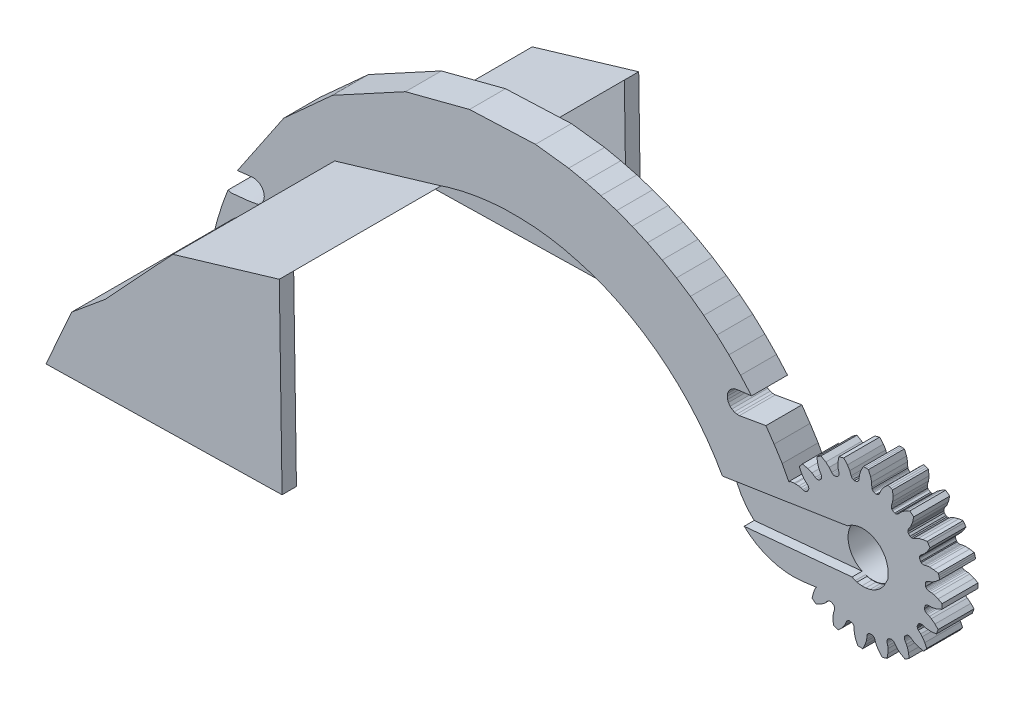
from build123d import *

# Parameters (mm, degrees)
EXTRUDE_1_DEPTH       = 5
EXTRUDE_4_DEPTH       = 1.4
EXTRUDE_6_DEPTH       = 22.5
EXTRUDE_8_DEPTH       = 2
EXTRUDE_9_DEPTH       = 27.5
EXTRUDE_10_DEPTH      = 2
EXTRUDE_11_DEPTH      = 10
EXTRUDE_11_DEPTH_BACK = 10
SKETCH_9_R            = 3.466997203


with BuildPart() as part:
    # 草图1 → 凸台-拉伸1 (new body)
    with BuildSketch(Plane.XY):
        with BuildLine():
            Line((78.264656067, 198.610534668), (77.453453766, 196.42377973))
            Line((77.453453766, 196.42377973), (76.780570984, 194.258041382))
            Line((76.780570984, 194.258041382), (76.215156555, 192.028518677))
            Line((76.215156555, 192.028518677), (75.769775391, 189.771942139))
            Line((75.769775391, 189.771942139), (75.44568634, 187.494781494))
            add(Edge.make_bspline(
                [(75.44568634, 187.494781494), (76.927870314, 189.989071683), (79.030409969, 193.790267145), (83.395802647, 196.817035543), (88.428386409, 203.376900855), (94.316934386, 207.548074621), (99.727897644, 209.947021484)],
                knots=[0, 0, 0, 0, 0.264078705, 0.372827909, 0.469719962, 1, 1, 1, 1], degree=3))
            Line((99.727897644, 209.947021484), (101.460605177, 211.048057001))
            Line((101.460605177, 211.048057001), (103.202568319, 211.994819762))
            Line((103.202568319, 211.994819762), (105.056091309, 212.862045288))
            Line((105.056091309, 212.862045288), (106.940231323, 213.609664917))
            Line((106.940231323, 213.609664917), (108.866714478, 214.240203857))
            Line((108.866714478, 214.240203857), (110.828269958, 214.751251221))
            Line((110.828269958, 214.751251221), (112.817504883, 215.140914917))
            Line((112.817504883, 215.140914917), (114.826911926, 215.407714844))
            Line((114.826911926, 215.407714844), (116.8489151, 215.550628662))
            Line((116.8489151, 215.550628662), (118.909233574, 215.550628662))
            Line((118.909233574, 215.550628662), (120.900138855, 215.463150024))
            Line((120.900138855, 215.463150024), (122.914085388, 215.233093262))
            Line((122.914085388, 215.233093262), (124.910102844, 214.879821777))
            Line((124.910102844, 214.879821777), (126.834763705, 214.391721334))
            Line((126.834763705, 214.391721334), (128.818344116, 213.809417725))
            Line((128.818344116, 213.809417725), (130.715805054, 213.096328735))
            Line((130.715805054, 213.096328735), (132.565917969, 212.268081665))
            Line((132.565917969, 212.268081665), (134.361694336, 211.327804565))
            Line((134.361694336, 211.327804565), (136.096343994, 210.279067993))
            Line((136.096343994, 210.279067993), (137.763336182, 209.125793457))
            Line((137.763336182, 209.125793457), (139.356369019, 207.872344971))
            Line((139.356369019, 207.872344971), (140.869445801, 206.523452759))
            Line((140.869445801, 206.523452759), (142.296859741, 205.084213257))
            Line((142.296859741, 205.084213257), (143.63319397, 203.560043335))
            Line((143.63319397, 203.560043335), (144.873443604, 201.956710815))
            Line((144.873443604, 201.956710815), (146.012908936, 200.280258179))
            Line((146.012908936, 200.280258179), (147.047302246, 198.537002563))
            Line((147.047302246, 198.537002563), (147.325256348, 198.023300171))
            Line((147.325256348, 198.023300171), (148.297051374, 196.133599791))
            Line((148.297051374, 196.133599791), (148.816299438, 195.392700195))
            Line((148.816299438, 195.392700195), (149.404052734, 194.672164917))
            Line((149.404052734, 194.672164917), (150.069362473, 193.996589296))
            Line((150.069362473, 193.996589296), (150.889770508, 193.31741333))
            Line((150.889770508, 193.31741333), (151.790487691, 192.704145824))
            Line((151.790487691, 192.704145824), (152.807807058, 192.192287023))
            Line((152.807807058, 192.192287023), (153.76713562, 191.833862305))
            Line((153.76713562, 191.833862305), (154.81427002, 191.556121826))
            Line((154.81427002, 191.556121826), (155.885299683, 191.393295288))
            Line((155.885299683, 191.393295288), (156.966659816, 191.341321766))
            Line((156.966659816, 191.341321766), (158.092749178, 191.411702351))
            Line((158.092749178, 191.411702351), (160.134979248, 191.670349121))
            Line((160.134979248, 191.670349121), (159.859750808, 191.266116086))
            Line((159.859750808, 191.266116086), (159.715805054, 190.809570312))
            Line((159.715805054, 190.809570312), (159.516505371, 190.058172624))
            Line((159.516505371, 190.058172624), (160.091796875, 189.630554199))
            Line((160.091796875, 189.630554199), (160.659439087, 189.90435791))
            Line((160.659439087, 189.90435791), (161.182632446, 190.255157471))
            Line((161.182632446, 190.255157471), (161.410995483, 190.463241577))
            Line((161.410995483, 190.463241577), (161.58543396, 190.677780151))
            Line((161.58543396, 190.677780151), (161.692504883, 190.791259766))
            Line((161.692504883, 190.791259766), (161.784912109, 190.863128662))
            Line((161.784912109, 190.863128662), (161.890118998, 190.917232229))
            Line((161.890118998, 190.917232229), (162.000886547, 190.946256775))
            Line((162.000886547, 190.946256775), (162.100771204, 190.952499566))
            Line((162.100771204, 190.952499566), (162.198223238, 190.926651523))
            Line((162.198223238, 190.926651523), (162.466125488, 190.783065796))
            Line((162.466125488, 190.783065796), (162.543994142, 190.709594727))
            Line((162.543994142, 190.709594727), (162.596600151, 190.63113649))
            Line((162.596600151, 190.63113649), (162.636917114, 190.538970947))
            Line((162.636917114, 190.538970947), (162.654587465, 190.399448921))
            Line((162.654587465, 190.399448921), (162.634307861, 190.225845337))
            Line((162.634307861, 190.225845337), (162.474197388, 189.679443359))
            Line((162.474197388, 189.679443359), (162.427825928, 189.057571411))
            Line((162.427825928, 189.057571411), (162.495518148, 188.297078962))
            Line((162.495518148, 188.297078962), (163.146405385, 188.053894213))
            Line((163.146405385, 188.053894213), (163.608964331, 188.475377332))
            Line((163.608964331, 188.475377332), (163.992094919, 188.99081764))
            Line((163.992094919, 188.99081764), (164.147079468, 189.251144409))
            Line((164.147079468, 189.251144409), (164.246673584, 189.509094238))
            Line((164.246673584, 189.509094238), (164.313430786, 189.650100708))
            Line((164.313430786, 189.650100708), (164.380578859, 189.748722308))
            Line((164.380578859, 189.748722308), (164.458311128, 189.831107215))
            Line((164.458311128, 189.831107215), (164.555194872, 189.896067471))
            Line((164.555194872, 189.896067471), (164.655181885, 189.928314209))
            Line((164.655181885, 189.928314209), (164.748458862, 189.936447144))
            Line((164.748458862, 189.936447144), (165.049590299, 189.878941092))
            Line((165.049590299, 189.878941092), (165.14407616, 189.842460216))
            Line((165.14407616, 189.842460216), (165.225631714, 189.780731201))
            Line((165.225631714, 189.780731201), (165.285394477, 189.703889737))
            Line((165.285394477, 189.703889737), (165.347625732, 189.579925537))
            Line((165.347625732, 189.579925537), (165.400436401, 188.834259033))
            Line((165.400436401, 188.834259033), (165.563063403, 188.213619025))
            Line((165.563063403, 188.213619025), (165.866304054, 187.520403633))
            Line((165.866304054, 187.520403633), (166.568621653, 187.486648071))
            Line((166.568621653, 187.486648071), (166.844284058, 188.049972534))
            Line((166.844284058, 188.049972534), (167.061340332, 188.641281128))
            Line((167.061340332, 188.641281128), (167.123794556, 188.943862915))
            Line((167.123794556, 188.943862915), (167.138793945, 189.219955444))
            Line((167.138793945, 189.219955444), (167.171852481, 189.380119324))
            Line((167.171852481, 189.380119324), (167.198473475, 189.509094238))
            Line((167.198473475, 189.509094238), (167.242706299, 189.59223938))
            Line((167.242706299, 189.59223938), (167.31602478, 189.683319092))
            Line((167.31602478, 189.683319092), (167.397766113, 189.744903564))
            Line((167.397766113, 189.744903564), (167.483963013, 189.781463623))
            Line((167.483963013, 189.781463623), (167.789428711, 189.822784424))
            Line((167.789428711, 189.822784424), (167.89175415, 189.81401062))
            Line((167.89175415, 189.81401062), (167.985916138, 189.780822754))
            Line((167.985916138, 189.780822754), (168.071075439, 189.725708008))
            Line((168.071075439, 189.725708008), (168.163986206, 189.627548218))
            Line((168.163986206, 189.627548218), (168.25302124, 189.470855713))
            Line((168.25302124, 189.470855713), (168.444641113, 188.934677124))
            Line((168.444641113, 188.934677124), (168.772659302, 188.404312134))
            Line((168.772659302, 188.404312134), (169.279785156, 187.824676514))
            Line((169.279785156, 187.824676514), (169.503845215, 187.883346558))
            Line((169.503845215, 187.883346558), (169.726623535, 187.946731567))
            Line((169.726623535, 187.946731567), (169.948028564, 188.014785767))
            Line((169.948028564, 188.014785767), (170.05595994, 188.636949007))
            Line((170.05595994, 188.636949007), (170.083877563, 189.264404297))
            Line((170.083877563, 189.264404297), (170.050202063, 189.570267264))
            Line((170.050202063, 189.570267264), (169.978729248, 189.838699341))
            Line((169.978729248, 189.838699341), (169.949859619, 189.992019653))
            Line((169.949859619, 189.992019653), (169.946044922, 190.109024048))
            Line((169.946044922, 190.109024048), (169.962524414, 190.224868774))
            Line((169.962524414, 190.224868774), (170.004104614, 190.334152222))
            Line((170.004104614, 190.334152222), (170.062805176, 190.41796875))
            Line((170.062805176, 190.41796875), (170.133483887, 190.479385376))
            Line((170.133483887, 190.479385376), (170.411224365, 190.613082886))
            Line((170.411224365, 190.613082886), (170.511276245, 190.63633728))
            Line((170.511276245, 190.63633728), (170.611068726, 190.633880615))
            Line((170.611068726, 190.633880615), (170.709091187, 190.607772827))
            Line((170.709091187, 190.607772827), (170.827789307, 190.543136597))
            Line((170.827789307, 190.543136597), (170.960891724, 190.421615601))
            Line((170.960891724, 190.421615601), (171.308807373, 189.970916748))
            Line((171.308807373, 189.970916748), (171.784667969, 189.567871094))
            Line((171.784667969, 189.567871094), (172.446090698, 189.173309326))
            Line((172.446090698, 189.173309326), (172.641067505, 189.298339844))
            Line((172.641067505, 189.298339844), (173.022888184, 189.56060791))
            Line((173.022888184, 189.56060791), (172.937896729, 190.185073853))
            Line((172.937896729, 190.185073853), (172.765945435, 190.791061401))
            Line((172.765945435, 190.791061401), (172.63861084, 191.072540283))
            Line((172.63861084, 191.072540283), (172.488464355, 191.304733276))
            Line((172.488464355, 191.304733276), (172.413635254, 191.441635132))
            Line((172.413635254, 191.441635132), (172.373840332, 191.551742554))
            Line((172.373840332, 191.551742554), (172.353713989, 191.666992188))
            Line((172.353713989, 191.666992188), (172.359481812, 191.783782959))
            Line((172.359481812, 191.783782959), (172.389419556, 191.881637573))
            Line((172.389419556, 191.881637573), (172.437652588, 191.961898804))
            Line((172.437652588, 191.961898804), (172.660491943, 192.174865723))
            Line((172.660491943, 192.174865723), (172.748458862, 192.227905273))
            Line((172.748458862, 192.227905273), (172.84413147, 192.256408691))
            Line((172.84413147, 192.256408691), (172.945419312, 192.261871338))
            Line((172.945419312, 192.261871338), (173.078277588, 192.237060547))
            Line((173.078277588, 192.237060547), (173.24176516, 192.163153056))
            Line((173.24176516, 192.163153056), (173.712585449, 191.841506958))
            Line((173.712585449, 191.841506958), (174.289703369, 191.605224609))
            Line((174.289703369, 191.605224609), (175.04069519, 191.434371948))
            Line((175.04069519, 191.434371948), (175.187469482, 191.613540649))
            Line((175.187469482, 191.613540649), (175.330444336, 191.795761108))
            Line((175.330444336, 191.795761108), (175.472895551, 191.977314194))
            Line((175.472895551, 191.977314194), (175.20033371, 192.548909475))
            Line((175.20033371, 192.548909475), (174.844955444, 193.071777344))
            Line((174.844955444, 193.071777344), (174.633390521, 193.31741333))
            Line((174.633390521, 193.31741333), (174.425745412, 193.480337017))
            Line((174.425745412, 193.480337017), (174.297353288, 193.581076776))
            Line((174.297353288, 193.581076776), (174.24680065, 193.687091796))
            Line((174.24680065, 193.687091796), (174.182235718, 193.77746582))
            Line((174.182235718, 193.77746582), (174.151626587, 193.890319824))
            Line((174.151626587, 193.890319824), (174.151626587, 193.996589296))
            Line((174.151626587, 193.996589296), (174.170944214, 194.083877563))
            Line((174.170944214, 194.083877563), (174.317047119, 194.355285645))
            Line((174.317047119, 194.355285645), (174.382469416, 194.438665908))
            Line((174.382469416, 194.438665908), (174.466506958, 194.489578247))
            Line((174.466506958, 194.489578247), (174.561157227, 194.526077271))
            Line((174.561157227, 194.526077271), (174.695175171, 194.543533325))
            Line((174.695175171, 194.543533325), (174.874282837, 194.523468018))
            Line((174.874282837, 194.523468018), (175.420669556, 194.363357544))
            Line((175.420669556, 194.363357544), (176.042556763, 194.316970825))
            Line((176.042556763, 194.316970825), (176.809570312, 194.386550903))
            Line((176.809570312, 194.386550903), (177.048568726, 195.038909912))
            Line((177.048568726, 195.038909912), (176.612747192, 195.494155884))
            Line((176.612747192, 195.494155884), (176.117446899, 195.883331299))
            Line((176.117446899, 195.883331299), (175.848983765, 196.036224365))
            Line((175.848983765, 196.036224365), (175.591033936, 196.135818481))
            Line((175.591033936, 196.135818481), (175.450012207, 196.202590942))
            Line((175.450012207, 196.202590942), (175.353118896, 196.268280029))
            Line((175.353118896, 196.268280029), (175.269088745, 196.349685669))
            Line((175.269088745, 196.349685669), (175.205108643, 196.447555542))
            Line((175.205108643, 196.447555542), (175.171813965, 196.544326782))
            Line((175.171813965, 196.544326782), (175.163665771, 196.63760376))
            Line((175.163665771, 196.63760376), (175.21875, 196.940887451))
            Line((175.21875, 196.940887451), (175.258743286, 197.035491943))
            Line((175.258743286, 197.035491943), (175.319381714, 197.11479187))
            Line((175.319381714, 197.11479187), (175.398132324, 197.178741455))
            Line((175.398132324, 197.178741455), (175.520187378, 197.23677063))
            Line((175.520187378, 197.23677063), (175.696731567, 197.273025513))
            Line((175.696731567, 197.273025513), (176.265869141, 197.289596558))
            Line((176.265869141, 197.289596558), (176.871643066, 197.437652588))
            Line((176.871643066, 197.437652588), (177.579362187, 197.743898648))
            Line((177.579362187, 197.743898648), (177.60408915, 198.438005701))
            Line((177.60408915, 198.438005701), (177.05015564, 198.733428955))
            Line((177.05015564, 198.733428955), (176.458831787, 198.950500488))
            Line((176.458831787, 198.950500488), (176.154274267, 199.005816077))
            Line((176.154274267, 199.005816077), (175.879499888, 199.026311565))
            Line((175.879499888, 199.026311565), (175.72000885, 199.055279298))
            Line((175.72000885, 199.055279298), (175.612960815, 199.08039856))
            Line((175.612960815, 199.08039856), (175.507888794, 199.131866455))
            Line((175.507888794, 199.131866455), (175.416793823, 199.205184937))
            Line((175.416793823, 199.205184937), (175.355224609, 199.28692627))
            Line((175.355224609, 199.28692627), (175.318649292, 199.373123169))
            Line((175.318649292, 199.373123169), (175.277328491, 199.678573608))
            Line((175.277328491, 199.678573608), (175.286117554, 199.780914307))
            Line((175.286117554, 199.780914307), (175.319290161, 199.875076294))
            Line((175.319290161, 199.875076294), (175.374420166, 199.960235596))
            Line((175.374420166, 199.960235596), (175.472579956, 200.053131104))
            Line((175.472579956, 200.053131104), (175.629272461, 200.142166138))
            Line((175.629272461, 200.142166138), (176.165435791, 200.33380127))
            Line((176.165435791, 200.33380127), (176.695800781, 200.661804199))
            Line((176.695800781, 200.661804199), (177.281288166, 201.166081262))
            Line((177.281288166, 201.166081262), (177.216766357, 201.393005371))
            Line((177.216766357, 201.393005371), (177.153396606, 201.615783691))
            Line((177.153396606, 201.615783691), (177.085342407, 201.837188721))
            Line((177.085342407, 201.837188721), (176.459790205, 201.950805316))
            Line((176.459790205, 201.950805316), (175.844705081, 201.972717191))
            Line((175.844705081, 201.972717191), (175.528656006, 201.938934326))
            Line((175.528656006, 201.938934326), (175.258956909, 201.873017693))
            Line((175.258956909, 201.873017693), (175.108093262, 201.839019775))
            Line((175.108093262, 201.839019775), (174.991088867, 201.835205078))
            Line((174.991088867, 201.835205078), (174.874282837, 201.8564201))
            Line((174.874282837, 201.8564201), (174.761504478, 201.896151124))
            Line((174.761504478, 201.896151124), (174.695175171, 201.939091061))
            Line((174.695175171, 201.939091061), (174.620727539, 202.022644043))
            Line((174.620727539, 202.022644043), (174.487045288, 202.300384521))
            Line((174.487045288, 202.300384521), (174.463775635, 202.400421143))
            Line((174.463775635, 202.400421143), (174.463775635, 202.500749883))
            Line((174.463775635, 202.500749883), (174.499846213, 202.603137895))
            Line((174.499846213, 202.603137895), (174.556991577, 202.716934204))
            Line((174.556991577, 202.716934204), (174.678497314, 202.850036621))
            Line((174.678497314, 202.850036621), (175.129211426, 203.197967529))
            Line((175.129211426, 203.197967529), (175.53225708, 203.673812866))
            Line((175.53225708, 203.673812866), (175.928875459, 204.335451875))
            Line((175.928875459, 204.335451875), (175.801773071, 204.530212402))
            Line((175.801773071, 204.530212402), (175.67342988, 204.726874228))
            Line((175.67342988, 204.726874228), (175.539505005, 204.91204834))
            Line((175.539505005, 204.91204834), (174.932685852, 204.829958907))
            Line((174.932685852, 204.829958907), (174.309066772, 204.655090332))
            Line((174.309066772, 204.655090332), (174.042688953, 204.526877164))
            Line((174.042688953, 204.526877164), (173.790767028, 204.405621919))
            Line((173.790767028, 204.405621919), (173.667177746, 204.316237506))
            Line((173.667177746, 204.316237506), (173.54838562, 204.263000488))
            Line((173.54838562, 204.263000488), (173.431262537, 204.247156283))
            Line((173.431262537, 204.247156283), (173.316760263, 204.251235327))
            Line((173.316760263, 204.251235327), (173.21986194, 204.285371926))
            Line((173.21986194, 204.285371926), (173.13822937, 204.326812744))
            Line((173.13822937, 204.326812744), (172.925247192, 204.5496521))
            Line((172.925247192, 204.5496521), (172.843704224, 204.733276367))
            Line((172.843704224, 204.733276367), (172.838241577, 204.834579468))
            Line((172.838241577, 204.834579468), (172.863052368, 204.967437744))
            Line((172.863052368, 204.967437744), (172.937484741, 205.131561279))
            Line((172.937484741, 205.131561279), (173.258621216, 205.601745605))
            Line((173.258621216, 205.601745605), (173.494888306, 206.178848267))
            Line((173.494888306, 206.178848267), (173.671154549, 206.930023))
            Line((173.671154549, 206.930023), (173.106703455, 207.361642905))
            Line((173.106703455, 207.361642905), (172.551513672, 207.084915161))
            Line((172.551513672, 207.084915161), (172.028335571, 206.734115601))
            Line((172.028335571, 206.734115601), (171.799972534, 206.526031494))
            Line((171.799972534, 206.526031494), (171.625549316, 206.31149292))
            Line((171.625549316, 206.31149292), (171.518463135, 206.198013306))
            Line((171.518463135, 206.198013306), (171.426055908, 206.126144409))
            Line((171.426055908, 206.126144409), (171.319196094, 206.072881406))
            Line((171.319196094, 206.072881406), (171.212419555, 206.042940274))
            Line((171.212419555, 206.042940274), (171.112853067, 206.042940274))
            Line((171.112853067, 206.042940274), (171.01625061, 206.06010437))
            Line((171.01625061, 206.06010437), (170.744842529, 206.206207275))
            Line((170.744842529, 206.206207275), (170.667221069, 206.273468018))
            Line((170.667221069, 206.273468018), (170.610534668, 206.355651855))
            Line((170.610534668, 206.355651855), (170.581810401, 206.458088789))
            Line((170.581810401, 206.458088789), (170.564108727, 206.588942603))
            Line((170.564108727, 206.588942603), (170.570206432, 206.760110424))
            Line((170.570206432, 206.760110424), (170.73677063, 207.309829712))
            Line((170.73677063, 207.309829712), (170.78314209, 207.93170166))
            Line((170.78314209, 207.93170166), (170.713577271, 208.698730469))
            Line((170.713577271, 208.698730469), (170.500880961, 208.785812124))
            Line((170.500880961, 208.785812124), (170.280334473, 208.862640381))
            Line((170.280334473, 208.862640381), (170.061203003, 208.937713623))
            Line((170.061203003, 208.937713623), (169.605957031, 208.50189209))
            Line((169.605957031, 208.50189209), (169.216781616, 208.006591797))
            Line((169.216781616, 208.006591797), (169.056104855, 207.738550731))
            Line((169.056104855, 207.738550731), (168.966445469, 207.481170654))
            Line((168.966445469, 207.481170654), (168.897537231, 207.339172363))
            Line((168.897537231, 207.339172363), (168.834645015, 207.234255532))
            Line((168.834645015, 207.234255532), (168.750427246, 207.158233643))
            Line((168.750427246, 207.158233643), (168.659569755, 207.095564578))
            Line((168.659569755, 207.095564578), (168.557736141, 207.067009488))
            Line((168.557736141, 207.067009488), (168.462524414, 207.052825928))
            Line((168.462524414, 207.052825928), (168.159240723, 207.107910156))
            Line((168.159240723, 207.107910156), (168.064620972, 207.147888184))
            Line((168.064620972, 207.147888184), (167.985321045, 207.20854187))
            Line((167.985321045, 207.20854187), (167.92137146, 207.287277222))
            Line((167.92137146, 207.287277222), (167.860116264, 207.410171509))
            Line((167.860116264, 207.410171509), (167.827102661, 207.585891724))
            Line((167.827102661, 207.585891724), (167.810516357, 208.155029297))
            Line((167.810516357, 208.155029297), (167.662460327, 208.760787964))
            Line((167.662460327, 208.760787964), (167.360879369, 209.471522562))
            Line((167.360879369, 209.471522562), (167.128036499, 209.482223511))
            Line((167.128036499, 209.482223511), (166.896575928, 209.490783691))
            Line((166.896575928, 209.490783691), (166.664978027, 209.494476318))
            Line((166.664978027, 209.494476318), (166.366699219, 208.939300537))
            Line((166.366699219, 208.939300537), (166.149627686, 208.347991943))
            Line((166.149627686, 208.347991943), (166.087173462, 208.045410156))
            Line((166.087173462, 208.045410156), (166.076917315, 207.768091983))
            Line((166.076917315, 207.768091983), (166.052246094, 207.614578247))
            Line((166.052246094, 207.614578247), (166.019714355, 207.502120972))
            Line((166.019714355, 207.502120972), (165.96824646, 207.397033691))
            Line((165.96824646, 207.397033691), (165.894927979, 207.305953979))
            Line((165.894927979, 207.305953979), (165.813201904, 207.244369507))
            Line((165.813201904, 207.244369507), (165.72670336, 207.207666195))
            Line((165.72670336, 207.207666195), (165.421539307, 207.166488647))
            Line((165.421539307, 207.166488647), (165.321823853, 207.182513937))
            Line((165.321823853, 207.182513937), (165.225631714, 207.210340482))
            Line((165.225631714, 207.210340482), (165.139892578, 207.263565063))
            Line((165.139892578, 207.263565063), (165.046981812, 207.361724854))
            Line((165.046981812, 207.361724854), (164.957962036, 207.518432617))
            Line((164.957962036, 207.518432617), (164.766326904, 208.054595947))
            Line((164.766326904, 208.054595947), (164.438323975, 208.584960938))
            Line((164.438323975, 208.584960938), (163.923599984, 209.162638471))
            Line((163.923599984, 209.162638471), (163.257487464, 208.975854341))
            Line((163.257487464, 208.975854341), (163.146405385, 208.364256726))
            Line((163.146405385, 208.364256726), (163.127075195, 207.724868774))
            Line((163.127075195, 207.724868774), (163.161193848, 207.417800903))
            Line((163.161193848, 207.417800903), (163.23223877, 207.15057373))
            Line((163.23223877, 207.15057373), (163.26109314, 206.997253418))
            Line((163.26109314, 206.997253418), (163.264923096, 206.880249023))
            Line((163.264923096, 206.880249023), (163.248458862, 206.764404297))
            Line((163.248458862, 206.764404297), (163.206863403, 206.65512085))
            Line((163.206863403, 206.65512085), (163.144140898, 206.57719091))
            Line((163.144140898, 206.57719091), (163.068711768, 206.509981818))
            Line((163.068711768, 206.509981818), (162.799743652, 206.376190186))
            Line((162.799743652, 206.376190186), (162.699707031, 206.352935791))
            Line((162.699707031, 206.352935791), (162.599899292, 206.355392456))
            Line((162.599899292, 206.355392456), (162.501876831, 206.381500244))
            Line((162.501876831, 206.381500244), (162.383178711, 206.446151733))
            Line((162.383178711, 206.446151733), (162.250091553, 206.567657471))
            Line((162.250091553, 206.567657471), (161.902145386, 207.018356323))
            Line((161.902145386, 207.018356323), (161.426300049, 207.421401978))
            Line((161.426300049, 207.421401978), (160.764877319, 207.815963745))
            Line((160.764877319, 207.815963745), (160.570456561, 207.685601414))
            Line((160.570456561, 207.685601414), (160.188079834, 207.428665161))
            Line((160.188079834, 207.428665161), (160.273071289, 206.804199219))
            Line((160.273071289, 206.804199219), (160.442893548, 206.198576392))
            Line((160.442893548, 206.198576392), (160.572357178, 205.916732788))
            Line((160.572357178, 205.916732788), (160.722488403, 205.684539795))
            Line((160.722488403, 205.684539795), (160.797332764, 205.547637939))
            Line((160.797332764, 205.547637939), (160.837127686, 205.437530518))
            Line((160.837127686, 205.437530518), (160.857254028, 205.322280884))
            Line((160.857254028, 205.322280884), (160.851470947, 205.205490112))
            Line((160.851470947, 205.205490112), (160.821548462, 205.107635498))
            Line((160.821548462, 205.107635498), (160.773300171, 205.027389526))
            Line((160.773300171, 205.027389526), (160.550476074, 204.814407349))
            Line((160.550476074, 204.814407349), (160.462524414, 204.761367798))
            Line((160.462524414, 204.761367798), (160.366836548, 204.73286438))
            Line((160.366836548, 204.73286438), (160.265548706, 204.727401733))
            Line((160.265548706, 204.727401733), (160.13269043, 204.752212524))
            Line((160.13269043, 204.752212524), (159.968551636, 204.826644897))
            Line((159.968551636, 204.826644897), (159.49836731, 205.147766113))
            Line((159.49836731, 205.147766113), (158.921265399, 205.384051762))
            Line((158.921265399, 205.384051762), (158.170288086, 205.554901123))
            Line((158.170288086, 205.554901123), (157.735604991, 205.014826601))
            Line((157.735604991, 205.014826601), (158.015213013, 204.440673828))
            Line((158.015213013, 204.440673828), (158.366012573, 203.917495728))
            Line((158.366012573, 203.917495728), (158.573646528, 203.684467011))
            Line((158.573646528, 203.684467011), (158.785147684, 203.514238694))
            Line((158.785147684, 203.514238694), (158.902114868, 203.407623291))
            Line((158.902114868, 203.407623291), (158.973968506, 203.315200806))
            Line((158.973968506, 203.315200806), (159.0287323, 203.211807251))
            Line((159.0287323, 203.211807251), (159.059326172, 203.098953247))
            Line((159.059326172, 203.098953247), (159.06111145, 202.996627808))
            Line((159.06111145, 202.996627808), (159.040023804, 202.905410767))
            Line((159.040023804, 202.905410767), (158.89390564, 202.633987427))
            Line((158.89390564, 202.633987427), (158.826644897, 202.556365967))
            Line((158.826644897, 202.556365967), (158.743699762, 202.500749883))
            Line((158.743699762, 202.500749883), (158.649810791, 202.463195801))
            Line((158.649810791, 202.463195801), (158.515792847, 202.445739746))
            Line((158.515792847, 202.445739746), (158.375748614, 202.461428804))
            Line((158.375748614, 202.461428804), (158.222161704, 202.50423498))
            Line((158.222161704, 202.50423498), (157.962077187, 202.589958836))
            Line((157.962077187, 202.589958836), (157.658298471, 202.646137092))
            Line((157.658298471, 202.646137092), (157.164762092, 202.673185882))
            Line((157.164762092, 202.673185882), (157.025326632, 202.670753143))
            Line((157.025326632, 202.670753143), (156.400737815, 202.603137895))
            Line((156.400737815, 202.603137895), (156.321672122, 202.400421143))
            Line((156.321672122, 202.400421143), (155.36459086, 204.207382032))
            Line((155.36459086, 204.207382032), (154.240004723, 205.977420774))
            Line((154.240004723, 205.977420774), (153.103302002, 207.640991211))
            Line((153.103302002, 207.640991211), (149.409133911, 206.995788574))
            Line((149.409133911, 206.995788574), (149.047531128, 206.996063232))
            Line((149.047531128, 206.996063232), (148.696487427, 207.082870483))
            Line((148.696487427, 207.082870483), (148.360832664, 207.263558309))
            Line((148.360832664, 207.263558309), (148.119004481, 207.473107872))
            Line((148.119004481, 207.473107872), (147.884734146, 207.815963745))
            Line((147.884734146, 207.815963745), (147.772766113, 208.127105713))
            Line((147.772766113, 208.127105713), (147.729446411, 208.486114502))
            Line((147.729446411, 208.486114502), (147.773300171, 208.845046997))
            Line((147.773300171, 208.845046997), (147.901779175, 209.183074951))
            Line((147.901779175, 209.183074951), (148.107421875, 209.480514526))
            Line((148.107421875, 209.480514526), (148.418437358, 209.722312761))
            Line((148.418437358, 209.722312761), (148.698577881, 209.887908936))
            Line((148.698577881, 209.887908936), (149.049743652, 209.974197388))
            Line((149.049743652, 209.974197388), (151.104205569, 210.2220985))
            Line((151.104205569, 210.2220985), (149.569458008, 211.948028564))
            Line((149.569458008, 211.948028564), (147.949272123, 213.593491603))
            Line((147.949272123, 213.593491603), (146.277947622, 215.140914917))
            Line((146.277947622, 215.140914917), (144.456207275, 216.601745605))
            Line((144.456207275, 216.601745605), (142.593658447, 217.962814331))
            Line((142.593658447, 217.962814331), (140.660812378, 219.222045898))
            Line((140.660812378, 219.222045898), (138.663208008, 220.375808716))
            Line((138.663208008, 220.375808716), (136.6065979, 221.420776367))
            Line((136.6065979, 221.420776367), (134.496917725, 222.35395813))
            Line((134.496917725, 222.35395813), (132.34022522, 223.172653198))
            Line((132.34022522, 223.172653198), (130.142730713, 223.874511719))
            Line((130.142730713, 223.874511719), (127.910758972, 224.457504272))
            Line((127.910758972, 224.457504272), (125.654673491, 224.933888878))
            Line((125.654673491, 224.933888878), (121.034524416, 225.494667842))
            Line((121.034524416, 225.494667842), (111.869003296, 225.113616943))
            Line((111.869003296, 225.113616943), (102.954216003, 222.797180176))
            Line((102.954216003, 222.797180176), (92.796514164, 217.282279968))
            Line((92.796514164, 217.282279968), (86.017402649, 211.136016846))
            Line((86.017402649, 211.136016846), (79.583046199, 201.615783691))
            Line((79.583046199, 201.615783691), (81.646858215, 201.840988159))
            ThreePointArc((81.646858215, 201.840988159), (83.104361355, 201.109282242), (83.035252269, 199.479885764))
            Line((83.035252269, 199.479885764), (82.896774934, 199.29541723))
            Line((82.896774934, 199.29541723), (82.634590149, 199.088027954))
            add(Edge.make_bspline(
                [(82.634590149, 199.088027954), (82.450326531, 198.950328876), (82.006575049, 198.862451818), (81.14520159, 198.723605018), (80.14607777, 198.625925791), (79.291624543, 198.519230334), (78.681711655, 198.479773691), (78.423946813, 198.545160861), (78.264656067, 198.610534668)],
                knots=[0, 0, 0, 0, 0.149458386, 0.302225078, 0.589252866, 0.825081291, 0.883387437, 1, 1, 1, 1], degree=3))
        make_face()
    extrude(amount=EXTRUDE_1_DEPTH)


with BuildPart() as body_2:
    # 草图2 → 凸台-拉伸4 (new body)
    with BuildSketch(Plane.XY.offset(5)):
        Polygon((147.047302246, 198.537002563), (164.479619828, 201.24250018), (165.540435791, 201.828659058), (166.755172729, 201.991439819), (167.963208907, 201.704412544), (168.98286438, 201.063293457), (169.722686768, 200.086181641), (170.080276489, 198.913925171), (170.080276489, 197.662679359), (169.818344116, 197.106277466), (169.525634766, 196.565200806), (169.142715454, 196.083740234), (168.681411743, 195.676742554), (168.155990601, 195.356811523), (167.582641602, 195.133804321), (166.979125977, 195.014633179), (166.453548983, 195.014633179), (165.756454468, 195.099182129), (165.190348735, 195.405431601), (150.069362473, 193.996589296), (146.867739014, 193.047406324), (145.919684473, 197.40938479), align=None)
    extrude(amount=-EXTRUDE_4_DEPTH)


with BuildPart() as part_1:
    add(part.part)

    # Combine 4: cut body 2
    add(body_2.part, mode=Mode.SUBTRACT)

    # 草图3 → 凸台-拉伸6 (add)
    with BuildSketch(Plane.XY.offset(5)):
        Polygon((75.44568634, 187.494781494), (77.272204859, 190.527347895), (78.558744339, 192.400030673), (79.676656294, 193.754708364), (81.385356856, 195.35680937), (83.006157208, 196.70179824), (84.003937127, 197.70229165), (85.450957908, 199.418299029), (86.81252044, 200.945244737), (89.615686599, 203.612847636), (92.136489691, 205.598201856), (94.061453231, 206.907731611), (96.109126132, 208.135248166), (98.802759725, 209.52384562), (99.727897644, 209.947021484), (101.460605177, 211.048057001), (103.202568319, 211.994819762), (105.631968145, 213.090551038), (107.9034729, 213.924934387), (93.098971461, 209.52384562), (83.709949578, 199.418299029), (79.012472592, 195.52019137), align=None)
    extrude(amount=EXTRUDE_6_DEPTH)

    # 草图7 → 凸台-拉伸8 (add)
    with BuildSketch(Plane.XY.offset(27.5)):
        Polygon((75.44568634, 187.494781494), (108.286882614, 188.146483426), (107.9034729, 213.924934387), (93.098971461, 209.52384562), (83.709949578, 199.418299029), (79.012472592, 195.52019137), align=None)
    extrude(amount=-EXTRUDE_8_DEPTH)

    # 草图3<3> → 凸台-拉伸9 (add)
    with BuildSketch(Plane.XY.offset(5)):
        Polygon((75.44568634, 187.494781494), (77.272204859, 190.527347895), (78.558744339, 192.400030673), (79.676656294, 193.754708364), (81.385356856, 195.35680937), (83.006157208, 196.70179824), (84.003937127, 197.70229165), (85.450957908, 199.418299029), (86.81252044, 200.945244737), (89.615686599, 203.612847636), (92.136489691, 205.598201856), (94.061453231, 206.907731611), (96.109126132, 208.135248166), (98.802759725, 209.52384562), (99.727897644, 209.947021484), (101.460605177, 211.048057001), (103.202568319, 211.994819762), (105.631968145, 213.090551038), (107.9034729, 213.924934387), (93.098971461, 209.52384562), (83.709949578, 199.418299029), (79.012472592, 195.52019137), align=None)
    extrude(amount=-EXTRUDE_9_DEPTH)

    # 草图8 → 凸台-拉伸10 (add)
    with BuildSketch(Plane(origin=(0, 0, -22.5), x_dir=(-1, 0, 0), z_dir=(0, 0, -1))):
        Polygon((-107.9034729, 213.924934387), (-93.098971461, 209.52384562), (-83.709949578, 199.418299029), (-79.012472592, 195.52019137), (-75.44568634, 187.494781494), (-108.286882614, 188.146483426), align=None)
    extrude(amount=-EXTRUDE_10_DEPTH)


with BuildPart() as body_2_2:
    # 草图9 → 凸台-拉伸11 (new, two sides: drawn at the far end of the back side and taken through both)
    with BuildSketch(Plane.XY.offset(-EXTRUDE_11_DEPTH_BACK)):
        with Locations((166.592909109, 198.517698778)):
            Circle(SKETCH_9_R)
    extrude(amount=EXTRUDE_11_DEPTH + EXTRUDE_11_DEPTH_BACK)


with BuildPart() as part_2:
    add(part_1.part)

    # Combine 5: cut body 2 2
    add(body_2_2.part, mode=Mode.SUBTRACT)


solid = part_2.part
